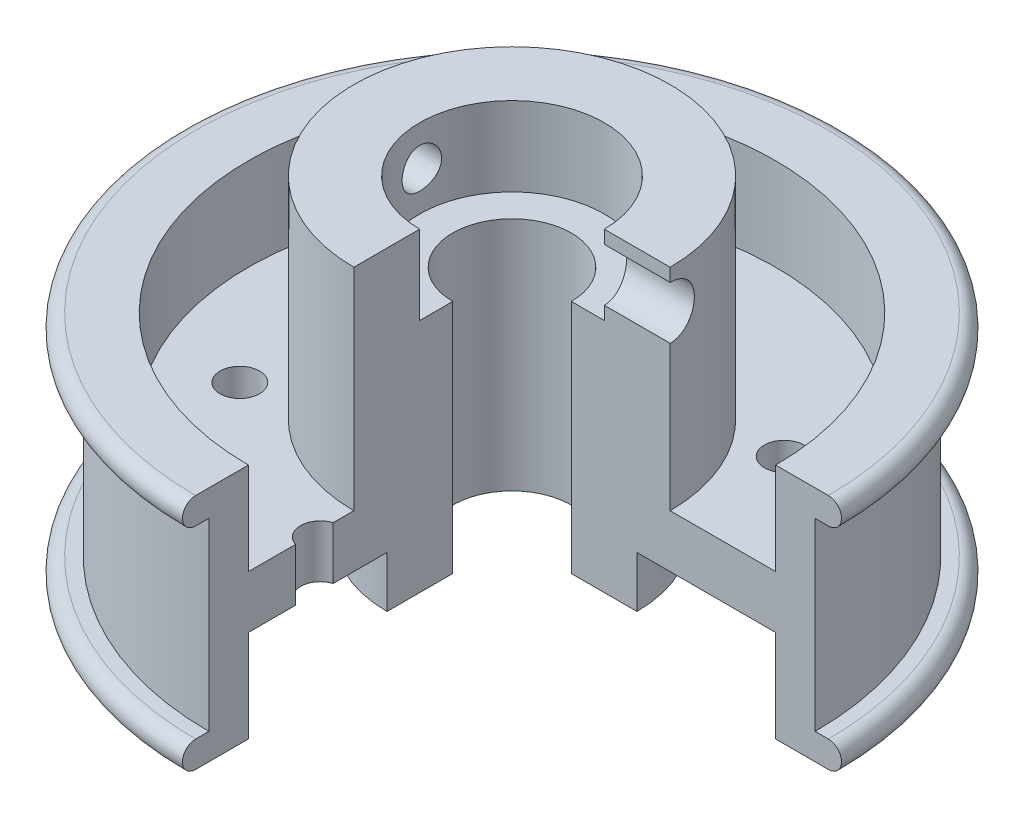
from build123d import *

# Parameters (mm, degrees)
FILLET2_R                = 6.35
FILLET3_R                = 6.35
CUT_EXTRUDE1_DEPTH       = 278.154041177
CUT_EXTRUDE1_DEPTH_BACK  = 278.154041177
SKETCH2_R                = 9.525
CUT_EXTRUDE12_DEPTH      = 283.485800584
CUT_EXTRUDE12_DEPTH_BACK = 283.485800584
SKETCH6_R                = 9.525
SKETCH6_3_R              = 12.7
SKETCH6_3_R_2            = 9.525
CUT_EXTRUDE13_DEPTH      = 256.54
CUT_EXTRUDE10_DEPTH      = 291.299888117
CUT_EXTRUDE10_DEPTH_BACK = 291.299888117
SKETCH5_W                = 230.453515198
SKETCH5_H                = 214.151634883


with BuildPart() as part:
    # Sketch1 → Revolve1 (revolve)
    with BuildSketch(Plane.XY):
        Polygon((0, 0), (-31.75, 0), (-31.75, -101.6), (-82.55, -101.6), (-82.55, -57.15), (-114.3, -57.15), (-114.3, -69.85), (-101.6, -69.85), (-101.6, -158.75), (-114.3, -158.75), (-114.3, -171.45), (-82.55, -171.45), (-82.55, -127), (-15.748, -127), (-15.748, -151.638), (15.875, -151.638), (15.875, -38.1), (0, -38.1), align=None)
    revolve(axis=Axis((44.45, 0, 0), (0, -1, 0)))

    # Fillet2
    fillet2_edges = [part.edges().sort_by_distance(p)[0] for p in [
        (203.2, -171.45, 0),
        (203.2, -158.75, 0),
    ]]
    fillet(fillet2_edges, radius=FILLET2_R - 0.0001)  # a hair under: the kernel refuses the full size

    # Fillet3
    fillet3_edges = [part.edges().sort_by_distance(p)[0] for p in [
        (203.2, -69.85, 0),
        (203.2, -57.15, 0),
    ]]
    fillet(fillet3_edges, radius=FILLET3_R - 0.0001)  # a hair under: the kernel refuses the full size

    # Sketch2 → Cut-Extrude1 (cut, two sides: drawn at the far end of the back side and taken through both)
    with BuildSketch(Plane(origin=(0, -101.6, 0), x_dir=(1, 0, 0), z_dir=(0, 1, 0)).offset(-CUT_EXTRUDE1_DEPTH_BACK)):
        with Locations(Location((-36.548636908, -50.11769467, 0), (0, 0, 180))):
            Circle(SKETCH2_R)
        with Locations(Location((-39.452515217, 45.088029899, 0), (0, 0, 180))):
            Circle(SKETCH2_R)
        with Locations(Location((47.353878309, -95.205724569, 0), (0, 0, 180))):
            Circle(SKETCH2_R)
        with Locations(Location((125.448636908, 50.11769467, 0), (0, 0, 180))):
            Circle(SKETCH2_R)
        with Locations(Location((128.352515217, -45.088029899, 0), (0, 0, 180))):
            Circle(SKETCH2_R)
        with Locations(Location((41.546121691, 95.205724569, 0), (0, 0, 180))):
            Circle(SKETCH2_R)
    extrude(amount=CUT_EXTRUDE1_DEPTH + CUT_EXTRUDE1_DEPTH_BACK, mode=Mode.SUBTRACT)

    # Sketch6 → Cut-Extrude12 (cut, two sides: drawn at the far end of the back side and taken through both)
    with BuildSketch(Plane(origin=(44.45, 0, 0), x_dir=(0, 0, -1), z_dir=(1, 0, 0)).offset(-CUT_EXTRUDE12_DEPTH_BACK)):
        with Locations((0, -19.05)):
            Circle(SKETCH6_R)
    extrude(amount=CUT_EXTRUDE12_DEPTH + CUT_EXTRUDE12_DEPTH_BACK, mode=Mode.SUBTRACT)

    # Sketch6<3> → Cut-Extrude13 (cut)
    with BuildSketch(Plane(origin=(44.45, 0, 0), x_dir=(0, 0, -1), z_dir=(1, 0, 0))):
        with Locations(Location((0, -19.05, 0), (0, 0, 180))):
            Circle(SKETCH6_3_R)
        with Locations(Location((0, -19.05, 0), (0, 0, 270))):
            Circle(SKETCH6_3_R_2, mode=Mode.SUBTRACT)
    extrude(amount=CUT_EXTRUDE13_DEPTH, mode=Mode.SUBTRACT)

    # Sketch5 → Cut-Extrude10 (cut, two sides: drawn at the far end of the back side and taken through both)
    with BuildSketch(Plane(origin=(0, -38.1, 0), x_dir=(1, 0, 0), z_dir=(0, 1, 0)).offset(-CUT_EXTRUDE10_DEPTH_BACK)):
        with Locations((159.676757599, -107.075817442)):
            Rectangle(SKETCH5_W, SKETCH5_H)
    extrude(amount=CUT_EXTRUDE10_DEPTH + CUT_EXTRUDE10_DEPTH_BACK, mode=Mode.SUBTRACT)


solid = part.part
